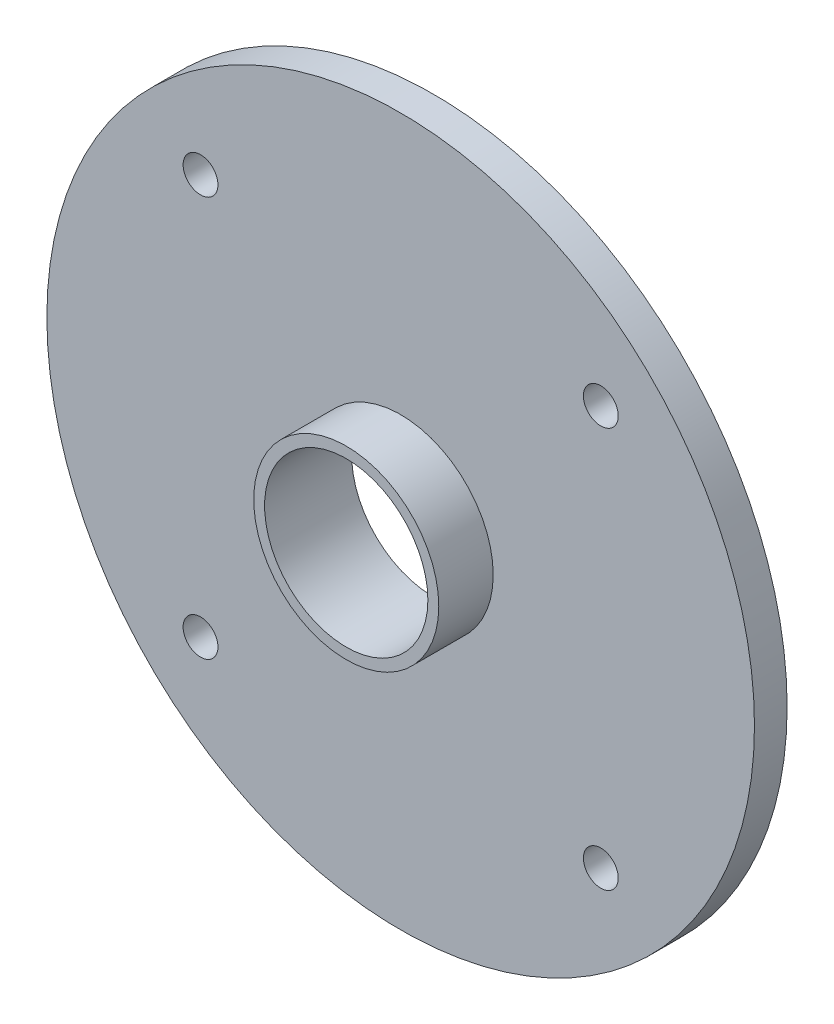
from build123d import *

# Parameters (mm, degrees)
SKETCH_1_R          = 32.5
EXTRUDE_1_DEPTH     = 3
SKETCH_2_R          = 7.5
CUT_EXTRUDE_1_DEPTH = 47.059743812
EXTRUDE_START       = 5
SKETCH_3_R          = 8.5
SKETCH_3_R_2        = 7.5
EXTRUDE_3_DEPTH     = 5
SKETCH_4_R          = 1.6
CUT_EXTRUDE_2_DEPTH = 47.233105022


with BuildPart() as part:
    # Эскиз1 → Бобышка-Вытянуть1 (new body)
    with BuildSketch(Plane.XY):
        Circle(SKETCH_1_R)
    extrude(amount=EXTRUDE_1_DEPTH)

    # Эскиз2 → Вырез-Вытянуть1 (cut, through all)
    with BuildSketch(Plane.XY.offset(3)):
        Circle(SKETCH_2_R)
    extrude(amount=-CUT_EXTRUDE_1_DEPTH, mode=Mode.SUBTRACT)

    # Эскиз3 → Бобышка-Вытянуть3 (add)
    with BuildSketch(Plane.XY.offset(3).offset(EXTRUDE_START)):
        Circle(SKETCH_3_R)
        Circle(SKETCH_3_R_2, mode=Mode.SUBTRACT)
    extrude(amount=-EXTRUDE_3_DEPTH)

    # Эскиз4 → Вырез-Вытянуть2 (cut, through all)
    with BuildSketch(Plane.XY.offset(3)):
        with Locations((-18.384776311, 18.384776311)):
            Circle(SKETCH_4_R)
        with Locations((18.384776311, 18.384776311)):
            Circle(SKETCH_4_R)
        with Locations((18.384776311, -18.384776311)):
            Circle(SKETCH_4_R)
        with Locations((-18.384776311, -18.384776311)):
            Circle(SKETCH_4_R)
    extrude(amount=-CUT_EXTRUDE_2_DEPTH, mode=Mode.SUBTRACT)


solid = part.part
